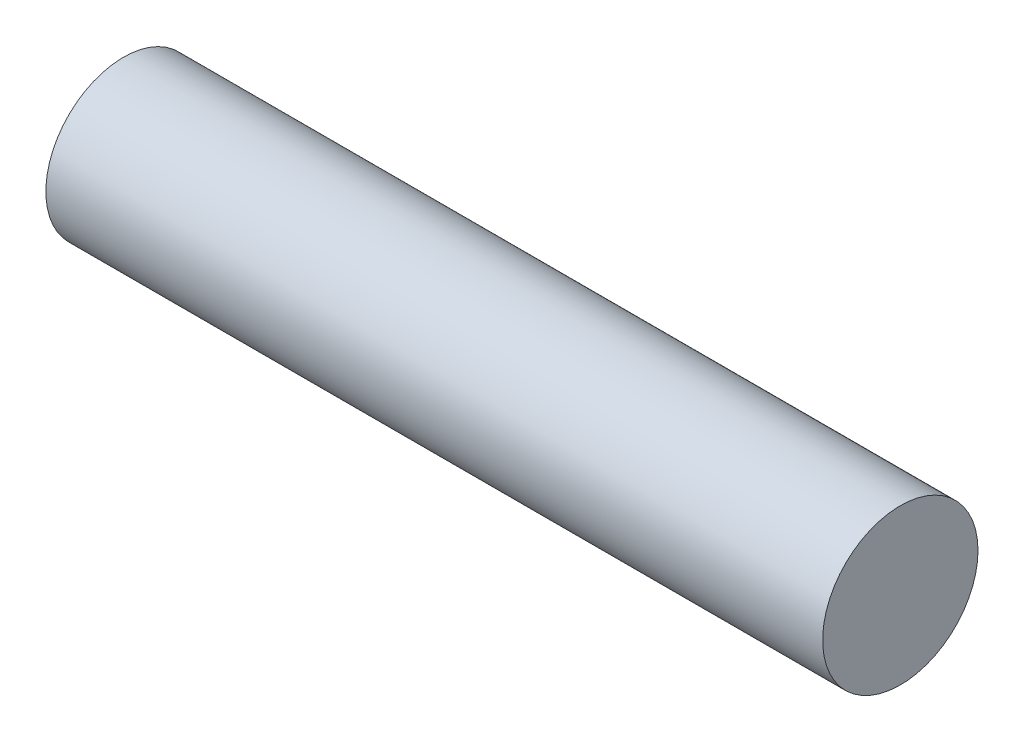
from build123d import *

# Parameters (mm, degrees)
SKETCH_1_R      = 1.5
EXTRUDE_1_DEPTH = 15


with BuildPart() as part:
    # 草图1 → 凸台-拉伸1 (new body)
    with BuildSketch(Plane(origin=(0, 0, 0), x_dir=(0, 0, -1), z_dir=(1, 0, 0))):
        Circle(SKETCH_1_R)
    extrude(amount=EXTRUDE_1_DEPTH)


solid = part.part
